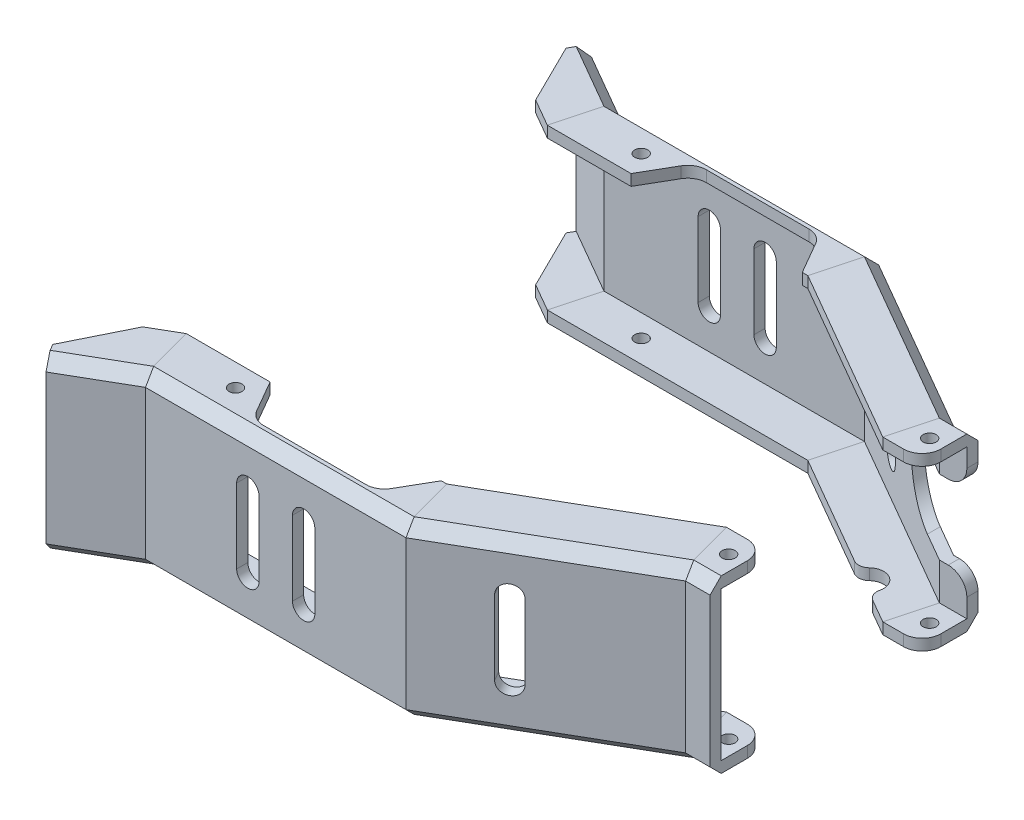
from build123d import *

# Parameters (mm, degrees)
CUT_EXTRUDE1_DEPTH         = 113.373698863
CUT_EXTRUDE3_DEPTH         = 5
CUT_EXTRUDE4_DEPTH         = 10
CHAMFER1_SIZE              = 3
CUT_EXTRUDE6_DEPTH         = 3
F_3_5_3_5_DIAMETER_HOLE1_D = 3.5
CUT_EXTRUDE9_DEPTH         = 10
CUT_EXTRUDE7_DEPTH         = 143.816147079
CUT_EXTRUDE7_DEPTH_BACK    = 5
FILLET1_R                  = 3
FILLET2_R                  = 3
FILLET3_R                  = 5
FILLET4_R                  = 5
FILLET5_R                  = 5
FILLET6_R                  = 5
FILLET7_R                  = 5


with BuildPart() as part:
    # Sweep8: sweep along a path in Sketch6
    with BuildLine(Plane(origin=(0, 0, 0), x_dir=(1, 0, 0), z_dir=(0, 1, 0))) as sweep8_path:
        Line((-87.320508076, -10), (-70, 0))
        Line((-70, 0), (0, 0))
        Line((0, 0), (47.631397208, 27.5))
        Line((47.631397208, 27.5), (54.631397208, 27.5))
    # Sketch7 → Sweep8 (sweep)
    with BuildSketch(Plane(origin=(0, 0, 0), x_dir=(0, 0, -1), z_dir=(1, 0, 0))):
        Polygon((-1.604651163, -23), (-1.604651163, 23), (13.395348837, 23), (13.395348837, 20), (1.395348837, 20), (1.395348837, -20), (13.395348837, -20), (13.395348837, -23), align=None)
    sweep(path=sweep8_path.line, transition=Transition.RIGHT)

    # Sketch8 → Cut-Extrude1 (cut, through all)
    with BuildSketch(Plane(origin=(0, 23, 0), x_dir=(1, 0, 0), z_dir=(0, 1, 0))):
        Polygon((-89.018182494, -7.059541652), (-94.018182494, 1.600712386), (-81.027801438, 9.100712386), align=None)
    extrude(amount=-CUT_EXTRUDE1_DEPTH, mode=Mode.SUBTRACT)

    # Sketch10 → Cut-Extrude3 (cut)
    with BuildSketch(Plane(origin=(0, 23, 0), x_dir=(1, 0, 0), z_dir=(0, 1, 0))):
        Polygon((-51.089272903, 13.395348837), (-5.089272903, 13.395348837), (-11.440125864, 2.395348837), (-44.738419942, 2.395348837), align=None)
    extrude(amount=-CUT_EXTRUDE3_DEPTH, mode=Mode.SUBTRACT)

    # Sketch11 → Cut-Extrude4 (cut)
    with BuildSketch(Plane.XY.offset(1.604651163)):
        with BuildLine():
            Line((-45.070035017, -10), (-45.070035017, 10))
            ThreePointArc((-45.070035017, 10), (-42.070035017, 13), (-39.070035017, 10))
            Line((-39.070035017, 10), (-39.070035017, -10))
            ThreePointArc((-39.070035017, -10), (-42.070035017, -13), (-45.070035017, -10))
        make_face()
        with BuildLine():
            Line((-24.070035017, -10), (-24.070035017, 10))
            ThreePointArc((-24.070035017, 10), (-27.070035017, 13), (-30.070035017, 10))
            Line((-30.070035017, 10), (-30.070035017, -10))
            ThreePointArc((-30.070035017, -10), (-27.070035017, -13), (-24.070035017, -10))
        make_face()
    extrude(amount=-CUT_EXTRUDE4_DEPTH, mode=Mode.SUBTRACT)

    # Chamfer1
    chamfer1_edges = [part.edges().sort_by_distance(p)[0] for p in [
        (-78.044108756, -23, 6.497159917),
        (-34.570035017, -23, 1.604651163),
        (24.245663587, -23, -12.145348837),
        (-78.044108756, 23, 6.497159917),
        (-34.570035017, 23, 1.604651163),
        (24.245663587, 23, -12.145348837),
        (51.3463797, -23, -25.895348837),
        (51.3463797, 23, -25.895348837),
    ]]
    chamfer(chamfer1_edges, length=CHAMFER1_SIZE)

    # Sketch14 → Cut-Extrude6 (cut)
    with BuildSketch(Plane(origin=(0.802325581, 0, 1.389668671), x_dir=(0.8660254037844379, 0, -0.5000000000000014), z_dir=(0.5000000000000014, 0, 0.8660254037844379))):
        with BuildLine():
            Line((17, -10), (17, 10))
            ThreePointArc((17, 10), (20, 13), (23, 10))
            Line((23, 10), (23, -10))
            ThreePointArc((23, -10), (20, -13), (17, -10))
        make_face()
    extrude(amount=-CUT_EXTRUDE6_DEPTH, mode=Mode.SUBTRACT)

    # Ø3.5 (3.5) Diameter Hole1 (through all)
    with Locations(Plane(origin=(0, -23, 0), x_dir=(-1, 0, 0), z_dir=(0, -1, 0))):
        with Locations((54.368602792, 7.395348837), (-50.631397208, 34.895348837)):
            Hole(F_3_5_3_5_DIAMETER_HOLE1_D / 2)

    # Sketch22 → Cut-Extrude9 (cut)
    with BuildSketch(Plane.XZ.offset(23)):
        with BuildLine():
            Line((28.953667037, -31.029323433), (28.453667037, -31.895348837))
            Line((28.453667037, -31.895348837), (35.381870267, -35.895348837))
            Line((35.381870267, -35.895348837), (35.881870267, -35.029323433))
            ThreePointArc((35.881870267, -35.029323433), (34.417768652, -29.565221818), (28.953667037, -31.029323433))
        make_face()
    extrude(amount=-CUT_EXTRUDE9_DEPTH, mode=Mode.SUBTRACT)


with BuildPart() as body_2:
    # Mirror2: mirrored copy
    add(part.part.mirror(Plane(origin=(0, 0, -61.895348837), x_dir=(1, 0, 0), z_dir=(0, 0, -1))))

    # Sketch20 → Cut-Extrude7 (cut, two sides: drawn at the far end of the back side and taken through both)
    with BuildSketch(Plane(origin=(0, 0, -97.895348837), x_dir=(-1, 0, 0), z_dir=(0, 0, -1)).offset(-CUT_EXTRUDE7_DEPTH_BACK)):
        with BuildLine():
            ThreePointArc((-39.631397208, -10), (-29.631397208, 0), (-39.631397208, 10))
            Line((-39.631397208, 10), (-54.631397208, 10))
            Line((-54.631397208, 10), (-54.631397208, -10))
            Line((-54.631397208, -10), (-39.631397208, -10))
        make_face()
    extrude(amount=CUT_EXTRUDE7_DEPTH + CUT_EXTRUDE7_DEPTH_BACK, mode=Mode.SUBTRACT)

    # Fillet2
    fillet2_edges = [body_2.edges().sort_by_distance(p)[0] for p in [
        (28.453667037, -21.5, -91.895348837),
        (35.381870267, -21.5, -87.895348837),
    ]]
    fillet(fillet2_edges, radius=FILLET2_R)

    # Fillet4
    fillet4_edges = [body_2.edges().sort_by_distance(p)[0] for p in [
        (54.631397208, 21.5, -82.895348837),
        (54.631397208, -21.5, -82.895348837),
    ]]
    fillet(fillet4_edges, radius=FILLET4_R)

    # Fillet5
    fillet5_edges = [body_2.edges().sort_by_distance(p)[0] for p in [
        (54.631397208, 10, -96.395348837),
        (54.631397208, -10, -96.395348837),
    ]]
    fillet(fillet5_edges, radius=FILLET5_R)

    # Fillet7
    fillet7_edges = [body_2.edges().sort_by_distance(p)[0] for p in [
        (-44.738419942, 21.5, -121.395348837),
        (-11.440125864, 21.5, -121.395348837),
    ]]
    fillet(fillet7_edges, radius=FILLET7_R)


with BuildPart() as part_1:
    add(part.part)

    # Fillet1
    fillet1_edges = [part_1.edges().sort_by_distance(p)[0] for p in [
        (28.453667037, -21.5, -31.895348837),
        (35.381870267, -21.5, -35.895348837),
    ]]
    fillet(fillet1_edges, radius=FILLET1_R)

    # Fillet3
    fillet3_edges = [part_1.edges().sort_by_distance(p)[0] for p in [
        (54.631397208, 21.5, -40.895348837),
        (54.631397208, -21.5, -40.895348837),
    ]]
    fillet(fillet3_edges, radius=FILLET3_R)

    # Fillet6
    fillet6_edges = [part_1.edges().sort_by_distance(p)[0] for p in [
        (-44.738419942, 21.5, -2.395348837),
        (-11.440125864, 21.5, -2.395348837),
    ]]
    fillet(fillet6_edges, radius=FILLET6_R)


solid = Compound([body_2.part, part_1.part])
